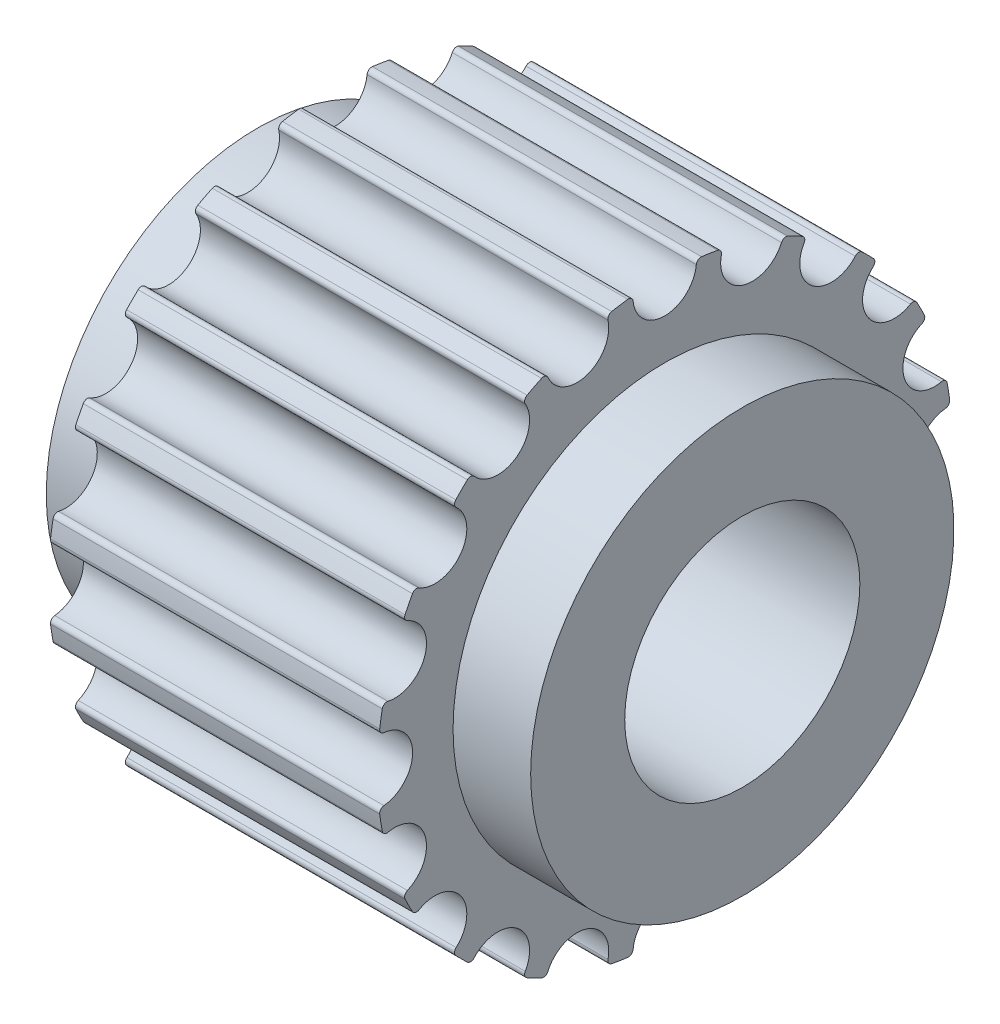
from build123d import *

# Parameters (mm, degrees)
CUT_EXTRUDE1_DEPTH       = 13.226475371
FILLET1_R                = 0.1
CIRPATTERN1_COUNT        = 20
FILLET1_OF_CIRPATTERN1_R = 0.1


with BuildPart() as part:
    # Sketch1 → Revolve1 (revolve)
    with BuildSketch(Plane.XY):
        Polygon((1.65, 6.11), (8.65, 6.11), (8.65, 4.5), (10.3, 4.5), (10.3, 2.5), (0, 2.5), (0, 4.5), (1.65, 4.5), align=None)
    revolve(axis=Axis((0, 0, 0), (1, 0, 0)))

    # Sketch2 → Cut-Extrude1 (cut, through all)
    with BuildSketch(Plane(origin=(1.65, 0, 0), x_dir=(0, 0, -1), z_dir=(1, 0, 0))):
        with BuildLine():
            ThreePointArc((0.673945392, 6.072717481), (0, 6.11), (-0.673945392, 6.072717481))
            ThreePointArc((-0.673945392, 6.072717481), (0, 5.36), (0.673945392, 6.072717481))
        make_face()
    cut_extrude1 = extrude(amount=CUT_EXTRUDE1_DEPTH, mode=Mode.SUBTRACT)

    # Fillet1
    fillet1_edges = [part.edges().sort_by_distance(p)[0] for p in [
        (5.15, 6.072717481, -0.673945392),
        (5.15, 6.072717481, 0.673945392),
    ]]
    fillet(fillet1_edges, radius=FILLET1_R)

    # CirPattern1: Cut-Extrude1 ×20 about axis
    cirpattern1_axis = Axis((0, 0, 0), (-1, 0, 0))
    for i in range(1, CIRPATTERN1_COUNT):
        add(cut_extrude1.rotate(cirpattern1_axis, i * 360 / CIRPATTERN1_COUNT), mode=Mode.SUBTRACT)

    # Fillet1 of CirPattern1
    fillet1_of_cirpattern1_edges = [part.edges().sort_by_distance(p)[0] for p in [
        (5.15, 5.567236953, -2.517533061),
        (5.15, 5.983758112, -1.235612747),
        (5.15, 4.516796482, -4.114687052),
        (5.15, 5.309066807, -3.024220501),
        (5.15, 3.024220501, -5.309066807),
        (5.15, 4.114687052, -4.516796482),
        (5.15, 1.235612747, -5.983758112),
        (5.15, 2.517533061, -5.567236953),
        (5.15, -0.673945392, -6.072717481),
        (5.15, 0.673945392, -6.072717481),
        (5.15, -2.517533061, -5.567236953),
        (5.15, -1.235612747, -5.983758112),
        (5.15, -4.114687052, -4.516796482),
        (5.15, -3.024220501, -5.309066807),
        (5.15, -5.309066807, -3.024220501),
        (5.15, -4.516796482, -4.114687052),
        (5.15, -5.983758112, -1.235612747),
        (5.15, -5.567236953, -2.517533061),
        (5.15, -6.072717481, 0.673945392),
        (5.15, -6.072717481, -0.673945392),
        (5.15, -5.567236953, 2.517533061),
        (5.15, -5.983758112, 1.235612747),
        (5.15, -4.516796482, 4.114687052),
        (5.15, -5.309066807, 3.024220501),
        (5.15, -3.024220501, 5.309066807),
        (5.15, -4.114687052, 4.516796482),
        (5.15, -1.235612747, 5.983758112),
        (5.15, -2.517533061, 5.567236953),
        (5.15, 0.673945392, 6.072717481),
        (5.15, -0.673945392, 6.072717481),
        (5.15, 2.517533061, 5.567236953),
        (5.15, 1.235612747, 5.983758112),
        (5.15, 4.114687052, 4.516796482),
        (5.15, 3.024220501, 5.309066807),
        (5.15, 5.309066807, 3.024220501),
        (5.15, 4.516796482, 4.114687052),
        (5.15, 5.983758112, 1.235612747),
        (5.15, 5.567236953, 2.517533061),
    ]]
    fillet(fillet1_of_cirpattern1_edges, radius=FILLET1_OF_CIRPATTERN1_R)


solid = part.part
